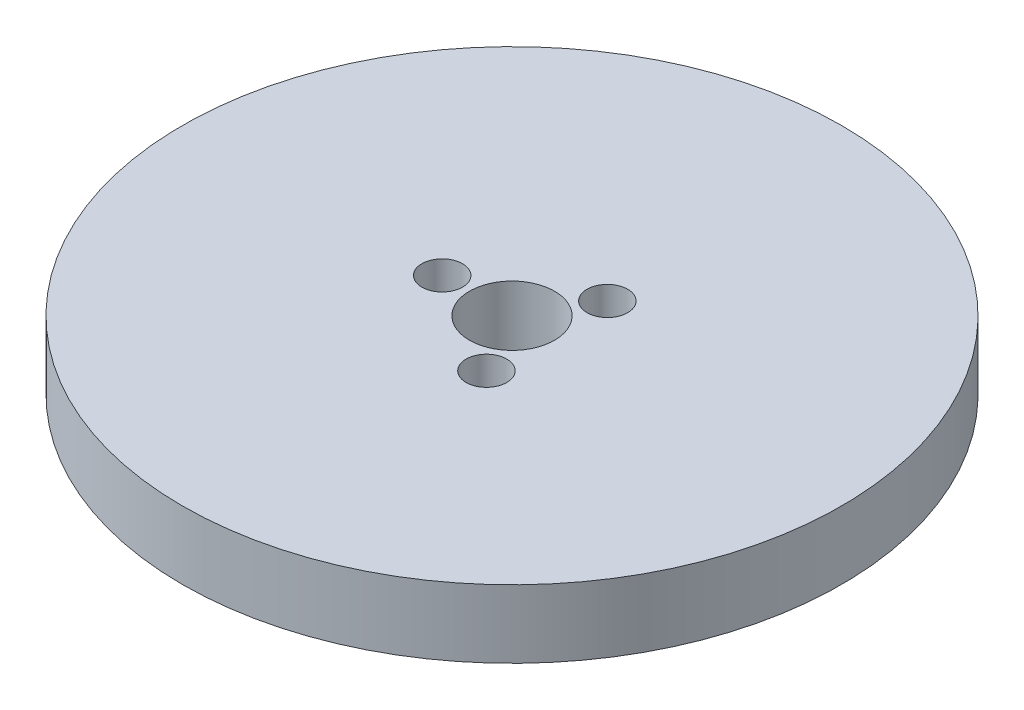
from build123d import *

# Parameters (mm, degrees)
SKETCH1_R           = 77.5
BOSS_EXTRUDE1_DEPTH = 16
SKETCH2_R           = 10
CUT_EXTRUDE1_DEPTH  = 111.763261057
SKETCH3_R           = 4.783682476
CUT_EXTRUDE2_DEPTH  = 15.152735102
CIRPATTERN1_COUNT   = 3


with BuildPart() as part:
    # Sketch1 → Boss-Extrude1 (new body)
    with BuildSketch(Plane(origin=(0, 0, 0), x_dir=(1, 0, 0), z_dir=(0, 1, 0))):
        Circle(SKETCH1_R)
    extrude(amount=BOSS_EXTRUDE1_DEPTH)

    # Sketch2 → Cut-Extrude1 (cut, through all)
    with BuildSketch(Plane(origin=(0, 0, 0), x_dir=(1, 0, 0), z_dir=(0, 1, 0))):
        Circle(SKETCH2_R)
    extrude(amount=CUT_EXTRUDE1_DEPTH, mode=Mode.SUBTRACT)

    # Sketch3 → Cut-Extrude2 (cut)
    with BuildSketch(Plane(origin=(0, 16, 0), x_dir=(1, 0, 0), z_dir=(0, 1, 0))):
        with Locations((-16.415394018, 0)):
            Circle(SKETCH3_R)
    cut_extrude2 = extrude(amount=-CUT_EXTRUDE2_DEPTH, mode=Mode.SUBTRACT)

    # CirPattern1: Cut-Extrude2 ×3 about axis
    cirpattern1_axis = Axis((0, 0, 0), (0, 1, 0))
    for i in range(1, CIRPATTERN1_COUNT):
        add(cut_extrude2.rotate(cirpattern1_axis, i * 360 / CIRPATTERN1_COUNT), mode=Mode.SUBTRACT)


solid = part.part
